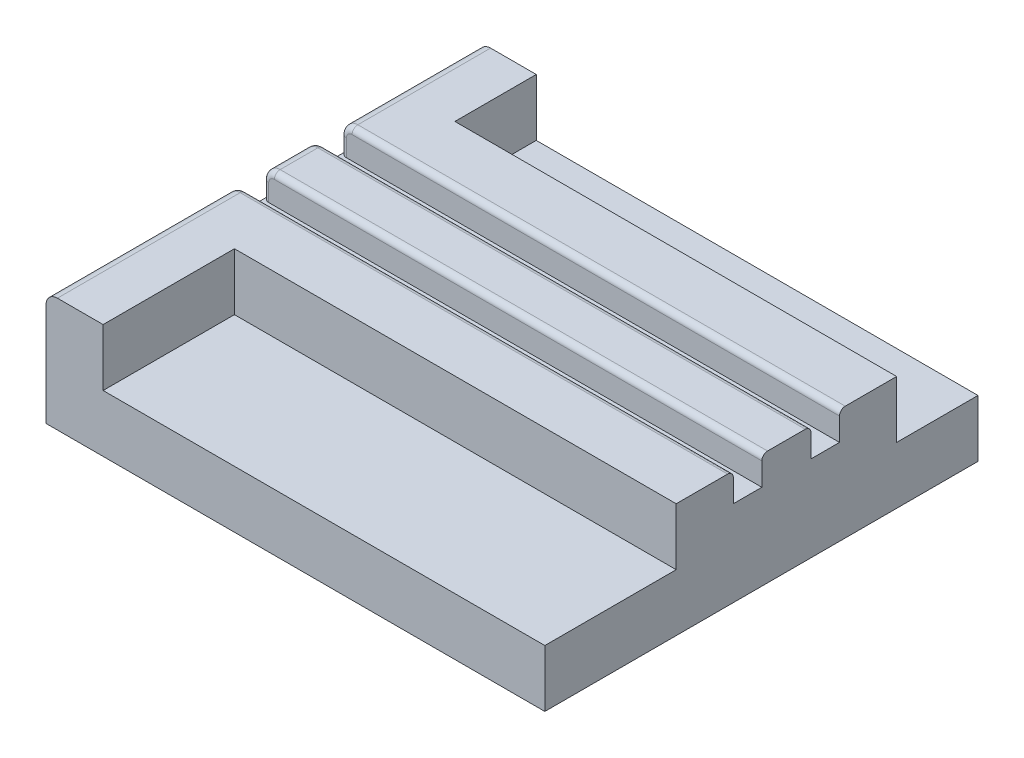
from build123d import *

# Parameters (mm, degrees)
SKETCH1_W                                  = 240
SKETCH1_H                                  = 200
BOSS_EXTRUDE1_DEPTH                        = 20
SKETCH7_W                                  = 120
SKETCH7_H                                  = 50
BOSS_EXTRUDE6_DEPTH                        = 20
FILLET1_R                                  = 2
SKETCH2_W                                  = 39.3
SKETCH2_H                                  = 125.7
CUT_EXTRUDE1_DEPTH                         = 10
CUT_EXTRUDE3_DEPTH                         = 5
MIRROR4_AT_THE_SECOND_PLANE_COPY_1_DEPTH   = 5
SKETCH11_W                                 = 104.748042719
SKETCH11_H                                 = 5
CUT_EXTRUDE4_DEPTH                         = 5
MIRROR6_AT_THE_SECOND_PLANE_COPY_1_SKETC_W = 104.748042719
MIRROR6_AT_THE_SECOND_PLANE_COPY_1_SKETC_H = 5
MIRROR6_AT_THE_SECOND_PLANE_COPY_1_DEPTH   = 5
SHELL1_START                               = 10
SHELL1_OUTLINE_W                           = 80.35
SHELL1_OUTLINE_H                           = 28.5
SHELL1_DEPTH                               = 10
FILLET3_R                                  = 1
SKETCH13_W                                 = 7.252545243
SKETCH13_H                                 = 2.335565418
SKETCH13_W_2                               = 1.720942939
SKETCH13_H_2                               = 2.581414408
CUT_EXTRUDE5_DEPTH                         = 2
CUT_EXTRUDE6_DEPTH                         = 10
MIRROR7_AT_THE_SECOND_PLANE_COPY_1_DEPTH   = 10
SKETCH15_W                                 = 101.789001661
SKETCH15_H                                 = 87.14110882
CUT_EXTRUDE7_DEPTH                         = 194.132079158
SKETCH16_W                                 = 160.143350343
SKETCH16_H                                 = 312.615723006
CUT_EXTRUDE9_DEPTH                         = 194.132079158
SKETCH17_W                                 = 90.552750052
SKETCH17_H                                 = 22.730212666
CUT_EXTRUDE10_DEPTH                        = 144.363951187


# Read off the part's stored shape, not the designer's step: Shell1
with BuildPart() as part:
    # Sketch1 → Boss-Extrude1 (new body)
    with BuildSketch(Plane(origin=(0, 0, 0), x_dir=(1, 0, 0), z_dir=(0, 1, 0))):
        Rectangle(SKETCH1_W, SKETCH1_H)
    extrude(amount=BOSS_EXTRUDE1_DEPTH)

    # Sketch7 → Boss-Extrude6 (add)
    with BuildSketch(Plane(origin=(0, 0, 0), x_dir=(1, 0, 0), z_dir=(0, 1, 0))):
        with Locations((0, 125)):
            Rectangle(SKETCH7_W, SKETCH7_H)
        with Locations((0, -125)):
            Rectangle(SKETCH7_W, SKETCH7_H)
    extrude(amount=BOSS_EXTRUDE6_DEPTH)

    # Fillet1
    fillet1_edges = [part.edges().sort_by_distance(p)[0] for p in [
        (-120, 20, 0),
        (90, 20, 100),
        (-90, 20, 100),
        (-60, 10, 150),
        (60, 10, 150),
        (-60, 20, 125),
        (0, 20, 150),
        (60, 20, 125),
        (-90, 20, -100),
        (60, 20, -125),
        (0, 20, -150),
        (60, 10, -150),
        (-60, 10, -150),
        (-60, 20, -125),
        (120, 20, 0),
        (120, 10, 100),
        (-120, 10, 100),
        (-120, 10, -100),
        (120, 10, -100),
        (90, 20, -100),
    ]]
    fillet(fillet1_edges, radius=FILLET1_R)

    # Sketch2 → Cut-Extrude1 (cut)
    with BuildSketch(Plane(origin=(0, 20, 0), x_dir=(1, 0, 0), z_dir=(0, 1, 0))):
        Rectangle(SKETCH2_W, SKETCH2_H)
    extrude(amount=-CUT_EXTRUDE1_DEPTH, mode=Mode.SUBTRACT)

    # Sketch10 → Cut-Extrude3 (cut)
    with BuildSketch(Plane(origin=(0, 20, 0), x_dir=(1, 0, 0), z_dir=(0, 1, 0))):
        Polygon((-9.25, -40.5), (-9.25, -33.162899401), (-4.25, -33.162899401), (-4.25, -40.5), (-4.25, -156.832928994), (-9.25, -156.832928994), align=None)
    cut_extrude3 = extrude(amount=-CUT_EXTRUDE3_DEPTH, mode=Mode.SUBTRACT)

    # Mirror4: Cut-Extrude3 across plane
    add(cut_extrude3.mirror(Plane(origin=(0, 0, 0), x_dir=(0, 0, 1), z_dir=(1, 0, 0))), mode=Mode.SUBTRACT)

    # Mirror4 at the second plane: Cut-Extrude3 across plane
    add(cut_extrude3.mirror(Plane.XY), mode=Mode.SUBTRACT)

    # Mirror4 at the second plane copy 1 sketc → Mirror4 at the second plane copy 1 (cut)
    with BuildSketch(Plane(origin=(0, 20, 0), x_dir=(-1, 0, 0), z_dir=(0, 1, 0))):
        Polygon((-9.25, -40.5), (-9.25, -33.162899401), (-4.25, -33.162899401), (-4.25, -40.5), (-4.25, -156.832928994), (-9.25, -156.832928994), align=None)
    extrude(amount=-MIRROR4_AT_THE_SECOND_PLANE_COPY_1_DEPTH, mode=Mode.SUBTRACT)

    # Sketch11 → Cut-Extrude4 (cut)
    with BuildSketch(Plane(origin=(0, 20, 0), x_dir=(1, 0, 0), z_dir=(0, 1, 0))):
        with Locations((-72.024021359, 26.75)):
            Rectangle(SKETCH11_W, SKETCH11_H)
        with Locations((-72.024021359, 40.35)):
            Rectangle(SKETCH11_W, SKETCH11_H)
    cut_extrude4 = extrude(amount=-CUT_EXTRUDE4_DEPTH, mode=Mode.SUBTRACT)

    # Mirror6: Cut-Extrude4 across plane
    add(cut_extrude4.mirror(Plane.XY), mode=Mode.SUBTRACT)

    # Mirror6 at the second plane: Cut-Extrude4 across plane
    add(cut_extrude4.mirror(Plane(origin=(0, 0, 0), x_dir=(0, 0, 1), z_dir=(1, 0, 0))), mode=Mode.SUBTRACT)

    # Mirror6 at the second plane copy 1 sketc → Mirror6 at the second plane copy 1 (cut)
    with BuildSketch(Plane(origin=(0, 20, 0), x_dir=(-1, 0, 0), z_dir=(0, 1, 0))):
        with Locations((-72.024021359, 26.75)):
            Rectangle(MIRROR6_AT_THE_SECOND_PLANE_COPY_1_SKETC_W, MIRROR6_AT_THE_SECOND_PLANE_COPY_1_SKETC_H)
        with Locations((-72.024021359, 40.35)):
            Rectangle(MIRROR6_AT_THE_SECOND_PLANE_COPY_1_SKETC_W, MIRROR6_AT_THE_SECOND_PLANE_COPY_1_SKETC_H)
    extrude(amount=-MIRROR6_AT_THE_SECOND_PLANE_COPY_1_DEPTH, mode=Mode.SUBTRACT)

    # Shell1 outline → Shell1 (cut)
    with BuildSketch(Plane(origin=(0, 0, 0), x_dir=(1, 0, 0), z_dir=(0, 1, 0)).offset(SHELL1_START)):
        Polygon((-29.65, 72.85), (-19.25, 72.85), (-19.25, 140), (-50, 140), (-50, 90), (-110, 90), (-110, 52.85), (-29.65, 52.85), align=None)
        Polygon((19.25, 72.85), (29.65, 72.85), (29.65, 52.85), (110, 52.85), (110, 90), (50, 90), (50, 140), (19.25, 140), align=None)
        Polygon((-110, -52.85), (-110, -90), (-50, -90), (-50, -140), (-19.25, -140), (-19.25, -72.85), (-29.65, -72.85), (-29.65, -52.85), align=None)
        with Locations((-69.825, 0)):
            Rectangle(SHELL1_OUTLINE_W, SHELL1_OUTLINE_H)
        Polygon((29.65, -72.85), (19.25, -72.85), (19.25, -140), (50, -140), (50, -90), (110, -90), (110, -52.85), (29.65, -52.85), align=None)
        with Locations((69.825, 0)):
            Rectangle(SHELL1_OUTLINE_W, SHELL1_OUTLINE_H)
    extrude(amount=SHELL1_DEPTH, mode=Mode.SUBTRACT)

    # Fillet3
    fillet3_edges = [part.edges().sort_by_distance(p)[0] for p in [
        (-4.25, 16.5, 150),
        (-4.25, 19.414213562, 149.414213562),
        (-9.25, 16.5, 150),
        (-9.25, 19.414213562, 149.414213562),
        (-4.25, 20, 105.425),
        (-9.25, 20, 105.425),
        (-9.25, 19.414213562, -149.414213562),
        (-9.25, 16.5, -150),
        (-9.25, 20, -105.425),
        (-4.25, 16.5, -150),
        (-4.25, 19.414213562, -149.414213562),
        (-4.25, 20, -105.425),
        (9.25, 16.5, 150),
        (9.25, 20, 105.425),
        (9.25, 19.414213562, 149.414213562),
        (4.25, 16.5, 150),
        (4.25, 19.414213562, 149.414213562),
        (4.25, 20, 105.425),
        (4.25, 16.5, -150),
        (4.25, 19.414213562, -149.414213562),
        (9.25, 19.414213562, -149.414213562),
        (9.25, 16.5, -150),
        (4.25, 20, -105.425),
        (9.25, 20, -105.425),
        (-120, 16.5, -24.25),
        (-120, 16.5, -29.25),
        (-119.414213562, 19.414213562, -24.25),
        (-119.414213562, 19.414213562, -29.25),
        (-68.825, 20, -24.25),
        (-68.825, 20, -29.25),
        (-120, 16.5, -37.85),
        (-120, 16.5, -42.85),
        (-68.825, 20, -37.85),
        (-68.825, 20, -42.85),
        (-119.414213562, 19.414213562, -37.85),
        (-119.414213562, 19.414213562, -42.85),
        (68.825, 20, -29.25),
        (119.414213562, 19.414213562, -29.25),
        (119.414213562, 19.414213562, -24.25),
        (68.825, 20, -24.25),
        (120, 16.5, -29.25),
        (120, 16.5, -24.25),
        (68.825, 20, -42.85),
        (119.414213562, 19.414213562, -42.85),
        (119.414213562, 19.414213562, -37.85),
        (68.825, 20, -37.85),
        (120, 16.5, -42.85),
        (120, 16.5, -37.85),
        (-120, 16.5, 29.25),
        (-120, 16.5, 24.25),
        (-68.825, 20, 29.25),
        (-119.414213562, 19.414213562, 29.25),
        (-119.414213562, 19.414213562, 24.25),
        (-68.825, 20, 24.25),
        (-120, 16.5, 42.85),
        (-120, 16.5, 37.85),
        (-68.825, 20, 42.85),
        (-119.414213562, 19.414213562, 42.85),
        (-119.414213562, 19.414213562, 37.85),
        (-68.825, 20, 37.85),
        (120, 16.5, 24.25),
        (120, 16.5, 29.25),
        (119.414213562, 19.414213562, 24.25),
        (119.414213562, 19.414213562, 29.25),
        (68.825, 20, 24.25),
        (68.825, 20, 29.25),
        (120, 16.5, 37.85),
        (120, 16.5, 42.85),
        (68.825, 20, 37.85),
        (68.825, 20, 42.85),
        (119.414213562, 19.414213562, 37.85),
        (119.414213562, 19.414213562, 42.85),
    ]]
    fillet(fillet3_edges, radius=FILLET3_R)

    # Sketch13 → Cut-Extrude5 (cut)
    # profile 1 of 12: a face of its own
    with BuildSketch(Plane(origin=(0, 10, 0), x_dir=(1, 0, 0), z_dir=(0, 1, 0))):
        Polygon((2.787359078, 56.729654742), (2.787359078, 55.37748529), (5, 55.37748529), (5, 53.041919872), (2.787359078, 53.041919872), (2.787359078, 48.247864542), (0.880108701, 48.247864542), (-4.711035156, 52.886343558), (-4.711035156, 55.37748529), (0.943491644, 55.37748529), (0.943491644, 56.729654742), align=None)
        Polygon((0.943491644, 53.041919872), (-2.596349692, 53.041919872), (0.943491644, 50.110938929), align=None, mode=Mode.SUBTRACT)
    # profile 2 of 12: a face of its own
    with BuildSketch(Plane(origin=(0, 10, 0), x_dir=(1, 0, 0), z_dir=(0, 1, 0))):
        with BuildLine():
            Line((5, 47.141544081), (5, 39.520225351))
            Line((5, 39.520225351), (3.409664338, 39.520225351))
            add(Edge.make_bspline(
                [(3.409664338, 39.520225351), (3.190599668, 39.81675512), (2.747057383, 40.417141716), (2.167094132, 41.14339637), (1.704390868, 41.703253096), (1.381972101, 42.083056551), (1.083256561, 42.417759603), (0.887687077, 42.622007507), (0.79559811, 42.718182933)],
                knots=[0, 0, 0, 0, 1.605452287, 3.25057426, 4.046675402, 4.768563423, 5.420146126, 6, 6, 6, 6], degree=3))
            add(Edge.make_bspline(
                [(0.79559811, 42.718182933), (0.732570292, 42.782561984), (0.609352585, 42.908421315), (0.423765416, 43.085974145), (0.244476812, 43.249198615), (0.074088064, 43.400664381), (-0.092796487, 43.534082219), (-0.252790737, 43.654099684), (-0.406497488, 43.759962438), (-0.599845109, 43.881290453), (-0.837875375, 44.00401532), (-1.125540586, 44.112139625), (-1.412736444, 44.178491494), (-1.604945873, 44.187117789), (-1.699385013, 44.191356186)],
                knots=[0, 0, 0, 0, 1.090093853, 2.131104457, 3.107135244, 4.023908394, 4.888948297, 5.691514549, 6.4435893, 7.146498757, 8.452673016, 9.675803408, 10.85804184, 12, 12, 12, 12], degree=3))
            add(Edge.make_bspline(
                [(-1.699385013, 44.191356186), (-1.754483363, 44.189605987), (-1.861179083, 44.186216799), (-2.017224671, 44.167846758), (-2.162681909, 44.132103765), (-2.300488192, 44.087839319), (-2.42643972, 44.024206924), (-2.544199113, 43.950411254), (-2.650531499, 43.859818439), (-2.749307162, 43.758726543), (-2.834556733, 43.642742478), (-2.911599654, 43.517157005), (-2.971430142, 43.377241787), (-3.024398474, 43.226819474), (-3.063653395, 43.063897589), (-3.092633036, 42.889340485), (-3.109905835, 42.703165878), (-3.111960528, 42.574807759), (-3.113016713, 42.508827152)],
                knots=[0, 0, 0, 0, 1.058578686, 2.049894692, 3.010224385, 3.931750511, 4.822578239, 5.71281177, 6.594427321, 7.498813824, 8.420995957, 9.353043897, 10.321837571, 11.3367408, 12.413304787, 13.535187771, 14.732999458, 16, 16, 16, 16], degree=3))
            add(Edge.make_bspline(
                [(-3.113016713, 42.508827152), (-3.110052719, 42.405568465), (-3.104041103, 42.196137688), (-3.053985994, 41.878413923), (-2.980602684, 41.552282773), (-2.873221808, 41.222921491), (-2.74714341, 40.895094854), (-2.596251992, 40.578640505), (-2.438170844, 40.269132893), (-2.314289691, 40.074405983), (-2.252545243, 39.977350819)],
                knots=[0, 0, 0, 0, 0.914703558, 1.855215137, 2.844920106, 3.875005138, 4.922433174, 5.955639304, 6.981056277, 8, 8, 8, 8], degree=3))
            Line((-2.252545243, 39.977350819), (-2.252545243, 39.766074342))
            Line((-2.252545243, 39.766074342), (-4.363389317, 39.766074342))
            add(Edge.make_bspline(
                [(-4.363389317, 39.766074342), (-4.396975153, 39.85152697), (-4.470639347, 40.038951181), (-4.568658946, 40.352153969), (-4.66491051, 40.720660415), (-4.763825821, 41.132864511), (-4.849735205, 41.573321973), (-4.910075419, 42.024211578), (-4.95119256, 42.474770211), (-4.954991729, 42.775713815), (-4.956884148, 42.92561802)],
                knots=[0, 0, 0, 0, 0.681686624, 1.495150967, 2.435076171, 3.509887788, 4.642826517, 5.765734475, 6.887081194, 8, 8, 8, 8], degree=3))
            add(Edge.make_bspline(
                [(-4.956884148, 42.92561802), (-4.954912362, 43.072306092), (-4.951074185, 43.357841566), (-4.914531776, 43.772464491), (-4.853049644, 44.160650299), (-4.769612134, 44.521836328), (-4.662431161, 44.856562797), (-4.529987596, 45.163893905), (-4.371768891, 45.443672956), (-4.191325, 45.69718541), (-3.986517109, 45.920499957), (-3.762299213, 46.116633841), (-3.516918106, 46.283180062), (-3.250583577, 46.417510178), (-2.964907945, 46.521931142), (-2.659732708, 46.596780352), (-2.333869778, 46.641015432), (-2.109911454, 46.646854566), (-1.995172081, 46.649846099)],
                knots=[0, 0, 0, 0, 1.302669921, 2.535710425, 3.693104205, 4.791067539, 5.825099944, 6.810730835, 7.758000335, 8.67487823, 9.568447078, 10.443087854, 11.315285082, 12.19521531, 13.085757283, 14.011200708, 14.981089066, 16, 16, 16, 16], degree=3))
            add(Edge.make_bspline(
                [(-1.995172081, 46.649846099), (-1.918295051, 46.648245135), (-1.764899121, 46.645050664), (-1.536586701, 46.623146341), (-1.311198259, 46.589276583), (-1.089189633, 46.538876948), (-0.870129482, 46.472993238), (-0.653296175, 46.39436831), (-0.439122967, 46.302496277), (-0.229338943, 46.193054838), (-0.018163961, 46.072147599), (0.191952814, 45.932794317), (0.405837655, 45.781094454), (0.620958688, 45.614342324), (0.835471411, 45.430057751), (1.055741697, 45.23549192), (1.273520634, 45.021368665), (1.417594688, 44.872241147), (1.490889788, 44.796375188)],
                knots=[0, 0, 0, 0, 0.907170522, 1.810115022, 2.704515666, 3.595334857, 4.494160497, 5.402400165, 6.316123003, 7.242010315, 8.19323076, 9.186549597, 10.215937183, 11.28746875, 12.397107329, 13.552885457, 14.755074217, 16, 16, 16, 16], degree=3))
            add(Edge.make_bspline(
                [(1.490889788, 44.796375188), (1.669671754, 44.600991906), (2.021428479, 44.216571794), (2.422503942, 43.720261203), (2.710127438, 43.347225494), (2.892573427, 43.11547907), (3.035611297, 42.923413887), (3.11966375, 42.809753418), (3.156132565, 42.760438229)],
                knots=[0, 0, 0, 0, 1.811045763, 3.563265038, 4.362127914, 5.033096026, 5.580478129, 6, 6, 6, 6], degree=3))
            Line((3.156132565, 42.760438229), (3.156132565, 47.141544081))
            Line((3.156132565, 47.141544081), (5, 47.141544081))
        make_face()
    # profile 3 of 12: a face of its own
    with BuildSketch(Plane(origin=(0, 10, 0), x_dir=(1, 0, 0), z_dir=(0, 1, 0))):
        with BuildLine():
            add(Edge.make_bspline(
                [(0.138720336, 37.553433421), (0.339837036, 37.551198694), (0.731017162, 37.546852061), (1.301575539, 37.503210957), (1.839727263, 37.435290008), (2.344336806, 37.340402007), (2.812295891, 37.218717557), (3.235819492, 37.059739443), (3.620265586, 36.877229499), (3.845547684, 36.720963882), (3.955141787, 36.64494457)],
                knots=[0, 0, 0, 0, 1.210994604, 2.355433537, 3.443919748, 4.476135166, 5.446013627, 6.351277171, 7.197937607, 8, 8, 8, 8], degree=3))
            add(Edge.make_bspline(
                [(3.955141787, 36.64494457), (4.057367971, 36.5617232), (4.260610648, 36.396265258), (4.524020765, 36.101981434), (4.745368417, 35.772676286), (4.897303004, 35.472877401), (4.999247268, 35.217133399), (5.063592063, 35.011802969), (5.122267484, 34.796985151), (5.167723638, 34.570405454), (5.201934481, 34.333084121), (5.226664862, 34.085073274), (5.242295446, 33.825562266), (5.244648027, 33.648682389), (5.245848991, 33.558387312)],
                knots=[0, 0, 0, 0, 1.363120718, 2.710110989, 4.070537742, 5.460816644, 6.180869889, 6.918733188, 7.687278466, 8.485437086, 9.309407483, 10.168795045, 11.065191617, 12, 12, 12, 12], degree=3))
            add(Edge.make_bspline(
                [(5.245848991, 33.558387312), (5.241905689, 33.384062955), (5.234297073, 33.047703496), (5.173081199, 32.562988904), (5.069699732, 32.118069919), (4.926806373, 31.711596248), (4.739854178, 31.34454147), (4.516760058, 31.013155063), (4.251279595, 30.717979546), (4.045332533, 30.554230832), (3.94169692, 30.471830054)],
                knots=[0, 0, 0, 0, 1.200851745, 2.317047666, 3.359233085, 4.342911255, 5.278031965, 6.189548012, 7.088953741, 8, 8, 8, 8], degree=3))
            add(Edge.make_bspline(
                [(3.94169692, 30.471830054), (3.829424185, 30.3947628), (3.600170882, 30.2373967), (3.214838014, 30.049115343), (2.792701976, 29.89168932), (2.331256748, 29.768085058), (1.834031119, 29.675388633), (1.301418942, 29.61187027), (0.734794995, 29.570336966), (0.344952566, 29.565716964), (0.144482422, 29.563341204)],
                knots=[0, 0, 0, 0, 0.822750793, 1.680001256, 2.58557045, 3.544707477, 4.565467581, 5.642347189, 6.787615291, 8, 8, 8, 8], degree=3))
            add(Edge.make_bspline(
                [(0.144482422, 29.563341204), (-0.061754837, 29.565532126), (-0.459970452, 29.569762495), (-1.036345286, 29.613069323), (-1.570746564, 29.680774054), (-2.065452333, 29.775711056), (-2.521358164, 29.900947264), (-2.938473361, 30.06222162), (-3.323134476, 30.249194002), (-3.55325365, 30.406272972), (-3.666176943, 30.483354226)],
                knots=[0, 0, 0, 0, 1.242237956, 2.39858964, 3.479780431, 4.485821505, 5.430991799, 6.32348679, 7.177307181, 8, 8, 8, 8], degree=3))
            add(Edge.make_bspline(
                [(-3.666176943, 30.483354226), (-3.769193286, 30.566416838), (-3.974708441, 30.732124775), (-4.238285133, 31.029639616), (-4.461065672, 31.362253167), (-4.645070962, 31.729678272), (-4.784115122, 32.135791847), (-4.885860052, 32.577168574), (-4.944671996, 33.056148657), (-4.952723667, 33.387282789), (-4.956884148, 33.558387312)],
                knots=[0, 0, 0, 0, 0.915406887, 1.826214983, 2.74012738, 3.682217607, 4.664024873, 5.706462388, 6.814877053, 8, 8, 8, 8], degree=3))
            add(Edge.make_bspline(
                [(-4.956884148, 33.558387312), (-4.955682618, 33.64868302), (-4.953320425, 33.826203271), (-4.937576888, 34.086978277), (-4.913381513, 34.337057391), (-4.877300412, 34.575699285), (-4.828262853, 34.80214551), (-4.773499009, 35.018778584), (-4.706561244, 35.224310597), (-4.601886899, 35.480626422), (-4.447267393, 35.781827029), (-4.217150947, 36.109134402), (-3.948246131, 36.405401156), (-3.739143401, 36.569659884), (-3.633525124, 36.652627351)],
                knots=[0, 0, 0, 0, 0.927772364, 1.823989051, 2.683453821, 3.508702832, 4.302191287, 5.063276402, 5.803871599, 6.520953588, 7.906777029, 9.27188215, 10.622021304, 12, 12, 12, 12], degree=3))
            add(Edge.make_bspline(
                [(-3.633525124, 36.652627351), (-3.521300204, 36.729189524), (-3.292789343, 36.885084383), (-2.908970475, 37.068290297), (-2.492360426, 37.225455121), (-2.036263275, 37.346342452), (-1.54437137, 37.439204828), (-1.015826808, 37.505677425), (-0.450933502, 37.546286922), (-0.061742996, 37.551003841), (0.138720336, 37.553433421)],
                knots=[0, 0, 0, 0, 0.826423845, 1.682753026, 2.582377666, 3.535958882, 4.552416628, 5.629628825, 6.779074777, 8, 8, 8, 8], degree=3))
        make_face()
        with BuildLine():
            add(Edge.make_bspline(
                [(0.138720336, 35.094943508), (-0.002794049, 35.093990238), (-0.275052116, 35.092156251), (-0.667644343, 35.074004214), (-1.028464631, 35.048543297), (-1.357952356, 35.010483072), (-1.656192237, 34.961169576), (-1.923473104, 34.900935006), (-2.158488294, 34.828227196), (-2.363936988, 34.745989678), (-2.54162794, 34.64913888), (-2.69467252, 34.537908006), (-2.823572221, 34.410664927), (-2.931286275, 34.270097317), (-3.011274034, 34.111739825), (-3.072443859, 33.941187009), (-3.106785969, 33.754382189), (-3.110895684, 33.625106618), (-3.113016713, 33.558387312)],
                knots=[0, 0, 0, 0, 1.684598718, 3.240982106, 4.677870026, 5.990101975, 7.188004416, 8.275163324, 9.249099904, 10.113910365, 10.905306099, 11.652292794, 12.358339015, 13.054983843, 13.750418457, 14.461547751, 15.206002611, 16, 16, 16, 16], degree=3))
            add(Edge.make_bspline(
                [(-3.113016713, 33.558387312), (-3.110895681, 33.491668012), (-3.106785962, 33.362392453), (-3.072443884, 33.175587552), (-3.011273943, 33.005035023), (-2.931286606, 32.84667649), (-2.823570979, 32.706112772), (-2.694677343, 32.578854684), (-2.541608299, 32.467684345), (-2.363496496, 32.37029911), (-2.157013742, 32.289020864), (-1.921590867, 32.215742751), (-1.654258135, 32.155647372), (-1.355414385, 32.106122047), (-1.024612933, 32.068276855), (-0.661244964, 32.04269777), (-0.266085327, 32.024665897), (0.008090715, 32.022799039), (0.150244508, 32.021831116)],
                knots=[0, 0, 0, 0, 0.791766581, 1.534129826, 2.243261137, 2.936741863, 3.631429404, 4.335491923, 5.08037989, 5.869552125, 6.738971147, 7.710171362, 8.794275798, 9.988812621, 11.304907075, 12.745337551, 14.312534512, 16, 16, 16, 16], degree=3))
            add(Edge.make_bspline(
                [(0.150244508, 32.021831116), (0.289201434, 32.022765136), (0.556986265, 32.024565091), (0.943773412, 32.043063349), (1.30096878, 32.067483158), (1.627502144, 32.109075315), (1.924420257, 32.156514098), (2.190195476, 32.220950105), (2.427221865, 32.292197549), (2.635687527, 32.376524358), (2.816464841, 32.475577579), (2.974492505, 32.586386469), (3.106149375, 32.714997304), (3.215613674, 32.855867424), (3.298888327, 33.012083539), (3.358752163, 33.181622444), (3.396338685, 33.365314373), (3.400067537, 33.492898418), (3.401981557, 33.558387312)],
                knots=[0, 0, 0, 0, 1.658832269, 3.196746878, 4.622488866, 5.931787449, 7.125569234, 8.210133994, 9.194149195, 10.078471196, 10.889203548, 11.650697572, 12.375032472, 13.07829054, 13.77251817, 14.478471121, 15.218999177, 16, 16, 16, 16], degree=3))
            add(Edge.make_bspline(
                [(3.401981557, 33.558387312), (3.400068186, 33.623876875), (3.3963406, 33.751462223), (3.358745104, 33.935144911), (3.298913291, 34.10471679), (3.215521541, 34.260812329), (3.106775331, 34.40178813), (2.97377315, 34.528364287), (2.816557237, 34.639341559), (2.635707586, 34.738476019), (2.42683161, 34.821967534), (2.190341985, 34.897522561), (1.921851262, 34.956560743), (1.624132619, 35.009519497), (1.295502071, 35.045529443), (0.936895825, 35.074962985), (0.547988509, 35.091838226), (0.278306115, 35.093884415), (0.138720336, 35.094943508)],
                knots=[0, 0, 0, 0, 0.778971247, 1.517574904, 2.221693305, 2.914116855, 3.615547377, 4.332711038, 5.092226179, 5.900851692, 6.782875619, 7.766611013, 8.854037796, 10.053520173, 11.366075456, 12.788704916, 14.337855446, 16, 16, 16, 16], degree=3))
        make_face(mode=Mode.SUBTRACT)
    # profile 4 of 12: a face of its own
    with BuildSketch(Plane(origin=(0, 10, 0), x_dir=(1, 0, 0), z_dir=(0, 1, 0))):
        with BuildLine():
            Line((5, 28.211171751), (5, 20.589853021))
            Line((5, 20.589853021), (3.409664338, 20.589853021))
            add(Edge.make_bspline(
                [(3.409664338, 20.589853021), (3.190599668, 20.88638279), (2.747057383, 21.486769386), (2.167094132, 22.21302404), (1.704390868, 22.772880767), (1.381972101, 23.152684221), (1.083256561, 23.487387273), (0.887687077, 23.691635177), (0.79559811, 23.787810603)],
                knots=[0, 0, 0, 0, 1.605452287, 3.25057426, 4.046675402, 4.768563423, 5.420146126, 6, 6, 6, 6], degree=3))
            add(Edge.make_bspline(
                [(0.79559811, 23.787810603), (0.732570292, 23.852189654), (0.609352585, 23.978048985), (0.423765416, 24.155601815), (0.244476812, 24.318826285), (0.074088064, 24.470292051), (-0.092796487, 24.60370989), (-0.252790737, 24.723727355), (-0.406497488, 24.829590108), (-0.599845109, 24.950918123), (-0.837875375, 25.07364299), (-1.125540586, 25.181767295), (-1.412736444, 25.248119164), (-1.604945873, 25.256745459), (-1.699385013, 25.260983856)],
                knots=[0, 0, 0, 0, 1.090093853, 2.131104457, 3.107135244, 4.023908394, 4.888948297, 5.691514549, 6.4435893, 7.146498757, 8.452673016, 9.675803408, 10.85804184, 12, 12, 12, 12], degree=3))
            add(Edge.make_bspline(
                [(-1.699385013, 25.260983856), (-1.754483363, 25.259233658), (-1.861179083, 25.25584447), (-2.017224671, 25.237474428), (-2.162681909, 25.201731435), (-2.300488192, 25.157466989), (-2.42643972, 25.093834595), (-2.544199113, 25.020038924), (-2.650531499, 24.929446109), (-2.749307162, 24.828354213), (-2.834556733, 24.712370148), (-2.911599654, 24.586784675), (-2.971430142, 24.446869457), (-3.024398474, 24.296447144), (-3.063653395, 24.133525259), (-3.092633036, 23.958968155), (-3.109905835, 23.772793548), (-3.111960528, 23.644435429), (-3.113016713, 23.578454822)],
                knots=[0, 0, 0, 0, 1.058578686, 2.049894692, 3.010224385, 3.931750511, 4.822578239, 5.71281177, 6.594427321, 7.498813824, 8.420995957, 9.353043897, 10.321837571, 11.3367408, 12.413304787, 13.535187771, 14.732999458, 16, 16, 16, 16], degree=3))
            add(Edge.make_bspline(
                [(-3.113016713, 23.578454822), (-3.110052719, 23.475196136), (-3.104041103, 23.265765358), (-3.053985994, 22.948041593), (-2.980602684, 22.621910443), (-2.873221808, 22.292549161), (-2.74714341, 21.964722525), (-2.596251992, 21.648268175), (-2.438170844, 21.338760563), (-2.314289691, 21.144033653), (-2.252545243, 21.046978489)],
                knots=[0, 0, 0, 0, 0.914703558, 1.855215137, 2.844920106, 3.875005138, 4.922433174, 5.955639304, 6.981056277, 8, 8, 8, 8], degree=3))
            Line((-2.252545243, 21.046978489), (-2.252545243, 20.835702012))
            Line((-2.252545243, 20.835702012), (-4.363389317, 20.835702012))
            add(Edge.make_bspline(
                [(-4.363389317, 20.835702012), (-4.396975153, 20.92115464), (-4.470639347, 21.108578851), (-4.568658946, 21.421781639), (-4.66491051, 21.790288086), (-4.763825821, 22.202492181), (-4.849735205, 22.642949643), (-4.910075419, 23.093839248), (-4.95119256, 23.544397881), (-4.954991729, 23.845341485), (-4.956884148, 23.99524569)],
                knots=[0, 0, 0, 0, 0.681686624, 1.495150967, 2.435076171, 3.509887788, 4.642826517, 5.765734475, 6.887081194, 8, 8, 8, 8], degree=3))
            add(Edge.make_bspline(
                [(-4.956884148, 23.99524569), (-4.954912362, 24.141933762), (-4.951074185, 24.427469237), (-4.914531776, 24.842092162), (-4.853049644, 25.230277969), (-4.769612134, 25.591463998), (-4.662431161, 25.926190468), (-4.529987596, 26.233521576), (-4.371768891, 26.513300626), (-4.191325, 26.76681308), (-3.986517109, 26.990127627), (-3.762299213, 27.186261512), (-3.516918106, 27.352807733), (-3.250583577, 27.487137848), (-2.964907945, 27.591558812), (-2.659732708, 27.666408023), (-2.333869778, 27.710643103), (-2.109911454, 27.716482236), (-1.995172081, 27.719473769)],
                knots=[0, 0, 0, 0, 1.302669921, 2.535710425, 3.693104205, 4.791067539, 5.825099944, 6.810730835, 7.758000335, 8.67487823, 9.568447078, 10.443087854, 11.315285082, 12.19521531, 13.085757283, 14.011200708, 14.981089066, 16, 16, 16, 16], degree=3))
            add(Edge.make_bspline(
                [(-1.995172081, 27.719473769), (-1.918295051, 27.717872805), (-1.764899121, 27.714678334), (-1.536586701, 27.692774011), (-1.311198259, 27.658904253), (-1.089189633, 27.608504619), (-0.870129482, 27.542620908), (-0.653296175, 27.46399598), (-0.439122967, 27.372123947), (-0.229338943, 27.262682508), (-0.018163961, 27.141775269), (0.191952814, 27.002421987), (0.405837655, 26.850722124), (0.620958688, 26.683969994), (0.835471411, 26.499685422), (1.055741697, 26.30511959), (1.273520634, 26.090996335), (1.417594688, 25.941868817), (1.490889788, 25.866002858)],
                knots=[0, 0, 0, 0, 0.907170522, 1.810115022, 2.704515666, 3.595334857, 4.494160497, 5.402400165, 6.316123003, 7.242010315, 8.19323076, 9.186549597, 10.215937183, 11.28746875, 12.397107329, 13.552885457, 14.755074217, 16, 16, 16, 16], degree=3))
            add(Edge.make_bspline(
                [(1.490889788, 25.866002858), (1.669671754, 25.670619576), (2.021428479, 25.286199464), (2.422503942, 24.789888873), (2.710127438, 24.416853164), (2.892573427, 24.18510674), (3.035611297, 23.993041557), (3.11966375, 23.879381088), (3.156132565, 23.830065899)],
                knots=[0, 0, 0, 0, 1.811045763, 3.563265038, 4.362127914, 5.033096026, 5.580478129, 6, 6, 6, 6], degree=3))
            Line((3.156132565, 23.830065899), (3.156132565, 28.211171751))
            Line((3.156132565, 28.211171751), (5, 28.211171751))
        make_face()
    # profile 5 of 12: a face of its own
    with BuildSketch(Plane(origin=(0, 10, 0), x_dir=(1, 0, 0), z_dir=(0, 1, 0))):
        Polygon((5, 13.583156769), (5, 11.124666856), (-1.524601746, 11.124666856), (2.664434583, 9.338420279), (2.664434583, 7.625160121), (-1.524601746, 5.838913543), (5, 5.838913543), (5, 3.503348126), (-4.711035156, 3.503348126), (-4.711035156, 6.382470298), (0.125275469, 8.549014533), (-4.711035156, 10.709796683), (-4.711035156, 13.583156769), align=None)
    # profile 6 of 12: a face of its own
    with BuildSketch(Plane(origin=(0, 10, 0), x_dir=(1, 0, 0), z_dir=(0, 1, 0))):
        Polygon((5, 1.4136317), (5, -5.593064552), (-4.711035156, -5.593064552), (-4.711035156, 1.4136317), (-2.867167722, 1.4136317), (-2.867167722, -3.134574639), (-1.146224782, -3.134574639), (-1.146224782, 1.044858213), (0.697642652, 1.044858213), (0.697642652, -3.134574639), (3.156132565, -3.134574639), (3.156132565, 1.4136317), align=None)
    # profile 7 of 12: a face of its own
    with BuildSketch(Plane(origin=(0, 10, 0), x_dir=(1, 0, 0), z_dir=(0, 1, 0))):
        with BuildLine():
            add(Edge.make_bspline(
                [(4.475650198, -7.805705474), (4.519354839, -7.923859504), (4.612512661, -8.17570855), (4.743574124, -8.583890089), (4.866671289, -9.047274178), (4.996208031, -9.552124696), (5.106381276, -10.084227717), (5.187397941, -10.625264318), (5.237323662, -11.165972628), (5.243010567, -11.526628491), (5.245848991, -11.706637515)],
                knots=[0, 0, 0, 0, 0.756485239, 1.612472169, 2.573171414, 3.635272123, 4.742182008, 5.834553763, 6.919191659, 8, 8, 8, 8], degree=3))
            add(Edge.make_bspline(
                [(5.245848991, -11.706637515), (5.241962961, -11.909112321), (5.234392087, -12.303579456), (5.17063924, -12.878829296), (5.062937634, -13.419584917), (4.916847086, -13.928231287), (4.72267015, -14.400885619), (4.491042888, -14.842463027), (4.211679163, -15.247896521), (3.893490591, -15.618759753), (3.53655883, -15.9505899), (3.145758166, -16.239699566), (2.72146993, -16.48347792), (2.264846611, -16.681095463), (1.776896349, -16.838089964), (1.255150105, -16.944841813), (0.702111097, -17.014888699), (0.322052776, -17.021601157), (0.127196165, -17.025042647)],
                knots=[0, 0, 0, 0, 1.160705024, 2.261318311, 3.313123859, 4.319096107, 5.290496718, 6.238021168, 7.172737693, 8.107230733, 9.03451477, 9.961071912, 10.888559376, 11.833805606, 12.808979065, 13.821966168, 14.883317984, 16, 16, 16, 16], degree=3))
            add(Edge.make_bspline(
                [(0.127196165, -17.025042647), (-0.058682323, -17.02067815), (-0.422730133, -17.012130168), (-0.955049114, -16.943336637), (-1.460067022, -16.832867692), (-1.937766829, -16.677677821), (-2.386372436, -16.473696921), (-2.808700267, -16.227656485), (-3.203463564, -15.935836699), (-3.565000576, -15.598836264), (-3.895700628, -15.226075236), (-4.177610929, -14.810267907), (-4.422741814, -14.363406013), (-4.616779655, -13.8775432), (-4.772219277, -13.359136807), (-4.876169413, -12.804694831), (-4.946971316, -12.216810998), (-4.953520434, -11.812500101), (-4.956884148, -11.604840667)],
                knots=[0, 0, 0, 0, 1.061573339, 2.079118747, 3.060574866, 4.011305467, 4.942696719, 5.870461571, 6.798745348, 7.740825567, 8.68941507, 9.638984161, 10.604583371, 11.595514188, 12.621960228, 13.691449096, 14.814297672, 16, 16, 16, 16], degree=3))
            add(Edge.make_bspline(
                [(-4.956884148, -11.604840667), (-4.954318925, -11.445386322), (-4.949235323, -11.129389392), (-4.919388643, -10.661251886), (-4.863951384, -10.205248288), (-4.792453594, -9.753475749), (-4.684946461, -9.294730481), (-4.534849919, -8.818874824), (-4.346707534, -8.316660693), (-4.193287983, -7.980233106), (-4.113698935, -7.805705474)],
                knots=[0, 0, 0, 0, 0.974479143, 1.931163549, 2.86485946, 3.780778834, 4.725046501, 5.741022375, 6.828116267, 8, 8, 8, 8], degree=3))
            Line((-4.113698935, -7.805705474), (-1.883771756, -7.805705474))
            Line((-1.883771756, -7.805705474), (-1.883771756, -8.091889065))
            add(Edge.make_bspline(
                [(-1.883771756, -8.091889065), (-1.906716104, -8.126531064), (-1.957410079, -8.203070203), (-2.043059993, -8.326945943), (-2.137489474, -8.476111594), (-2.284548962, -8.694884397), (-2.45960062, -8.978067997), (-2.581693909, -9.213466955), (-2.640525683, -9.326896107)],
                knots=[0, 0, 0, 0, 0.515980687, 1.140024195, 1.869947604, 2.707876564, 4.413660046, 6, 6, 6, 6], degree=3))
            add(Edge.make_bspline(
                [(-2.640525683, -9.326896107), (-2.672756546, -9.393740863), (-2.73882048, -9.530753251), (-2.823836627, -9.749019276), (-2.905177649, -9.981830174), (-2.978097, -10.22950925), (-3.037034138, -10.489919732), (-3.082413494, -10.759686706), (-3.106467195, -11.03779789), (-3.110821171, -11.225783758), (-3.113016713, -11.320577771)],
                knots=[0, 0, 0, 0, 0.861448091, 1.765719082, 2.717953576, 3.724891765, 4.761927522, 5.816719679, 6.89905606, 8, 8, 8, 8], degree=3))
            add(Edge.make_bspline(
                [(-3.113016713, -11.320577771), (-3.110164997, -11.430782772), (-3.104578279, -11.646682304), (-3.068710383, -11.963218824), (-3.004292393, -12.263584213), (-2.918860854, -12.549882667), (-2.805175217, -12.820581595), (-2.662381265, -13.075068024), (-2.499039638, -13.320076357), (-2.36711736, -13.466852812), (-2.300562624, -13.540901474)],
                knots=[0, 0, 0, 0, 1.091217493, 2.137773647, 3.148547478, 4.129133693, 5.092188092, 6.048375109, 7.015406034, 8, 8, 8, 8], degree=3))
            add(Edge.make_bspline(
                [(-2.300562624, -13.540901474), (-2.231129169, -13.608753509), (-2.090799964, -13.745886571), (-1.846186727, -13.91943259), (-1.579009792, -14.07619004), (-1.283734201, -14.208811415), (-0.962723927, -14.314570988), (-0.616833633, -14.387928819), (-0.248028071, -14.435679856), (0.006035391, -14.440927383), (0.136799641, -14.443628239)],
                knots=[0, 0, 0, 0, 0.871242595, 1.760833901, 2.686460846, 3.652134751, 4.663748384, 5.717797841, 6.825370436, 8, 8, 8, 8], degree=3))
            add(Edge.make_bspline(
                [(0.136799641, -14.443628239), (0.270078203, -14.441217619), (0.528956778, -14.436535262), (0.904701948, -14.395518364), (1.257245759, -14.329288021), (1.585144219, -14.233472949), (1.889752999, -14.11198958), (2.170660406, -13.964565335), (2.424839249, -13.78559248), (2.657673098, -13.584235453), (2.862193118, -13.352834409), (3.041867765, -13.096983341), (3.191530728, -12.813783401), (3.315763592, -12.506455713), (3.407777269, -12.172177215), (3.477785429, -11.813452581), (3.51753353, -11.428392977), (3.522401475, -11.163169785), (3.524906052, -11.026711399)],
                knots=[0, 0, 0, 0, 1.162877018, 2.258757441, 3.29433279, 4.289818334, 5.235063129, 6.152415668, 7.05144509, 7.94239879, 8.832861761, 9.739671241, 10.664582224, 11.622279774, 12.626959197, 13.685538709, 14.809200461, 16, 16, 16, 16], degree=3))
            add(Edge.make_bspline(
                [(3.524906052, -11.026711399), (3.524545414, -10.976125561), (3.523787414, -10.869802624), (3.51698298, -10.707868976), (3.511542352, -10.544994826), (3.50110347, -10.438303115), (3.496095624, -10.387119882)],
                knots=[0, 0, 0, 0, 0.947728294, 1.991965744, 3.036685378, 4, 4, 4, 4], degree=3))
            Line((3.496095624, -10.387119882), (1.435189626, -10.387119882))
            Line((1.435189626, -10.387119882), (1.435189626, -12.353911813))
            Line((1.435189626, -12.353911813), (-0.408677809, -12.353911813))
            Line((-0.408677809, -12.353911813), (-0.408677809, -7.805705474))
            Line((-0.408677809, -7.805705474), (4.475650198, -7.805705474))
        make_face()
    # profile 8 of 12: a face of its own
    with BuildSketch(Plane(origin=(0, 10, 0), x_dir=(1, 0, 0), z_dir=(0, 1, 0))):
        with Locations((1.373727378, -19.913768295)):
            Rectangle(SKETCH13_W, SKETCH13_H)
    # profile 9 of 12: a face of its own
    with BuildSketch(Plane(origin=(0, 10, 0), x_dir=(1, 0, 0), z_dir=(0, 1, 0))):
        with Locations((-4.219337174, -19.913768295)):
            Rectangle(SKETCH13_W_2, SKETCH13_H_2)
    # profile 10 of 12: a face of its own
    with BuildSketch(Plane(origin=(0, 10, 0), x_dir=(1, 0, 0), z_dir=(0, 1, 0))):
        with BuildLine():
            add(Edge.make_bspline(
                [(5.245848991, -30.773379208), (5.241556228, -30.949600555), (5.233101922, -31.296656552), (5.17328717, -31.807137753), (5.071443943, -32.296870987), (4.929457053, -32.76358831), (4.750483589, -33.205121013), (4.527408056, -33.614715808), (4.267338932, -33.994815031), (4.061606502, -34.220067298), (3.958983177, -34.332427496)],
                knots=[0, 0, 0, 0, 1.089850102, 2.146385891, 3.173869964, 4.179760968, 5.160008291, 6.115072822, 7.059761785, 8, 8, 8, 8], degree=3))
            add(Edge.make_bspline(
                [(3.958983177, -34.332427496), (3.848038568, -34.438295465), (3.624492228, -34.651612698), (3.240912088, -34.92404395), (2.819806379, -35.161121156), (2.440058042, -35.326067869), (2.118408243, -35.437370727), (1.865302565, -35.510926057), (1.602961267, -35.571890876), (1.331038558, -35.621175666), (1.050675199, -35.662875321), (0.76008365, -35.687900337), (0.460358885, -35.70657835), (0.257194686, -35.708560179), (0.154085898, -35.709565986)],
                knots=[0, 0, 0, 0, 1.326589366, 2.672993315, 4.060770367, 5.505883836, 6.25107509, 7.007321983, 7.7873399, 8.582269437, 9.400071632, 10.240855478, 11.107208546, 12, 12, 12, 12], degree=3))
            add(Edge.make_bspline(
                [(0.154085898, -35.709565986), (-0.036260272, -35.705853317), (-0.409159179, -35.698579988), (-0.954067146, -35.631518817), (-1.472101576, -35.524248732), (-1.962272567, -35.375865598), (-2.421254864, -35.182794221), (-2.847342954, -34.951680217), (-3.242424741, -34.683652344), (-3.47520079, -34.471076121), (-3.591269829, -34.365079315)],
                knots=[0, 0, 0, 0, 1.119324668, 2.1928203, 3.223958197, 4.228260008, 5.200520162, 6.147632129, 7.076354466, 8, 8, 8, 8], degree=3))
            add(Edge.make_bspline(
                [(-3.591269829, -34.365079315), (-3.696426816, -34.256022231), (-3.907914238, -34.036691095), (-4.17855444, -33.660997219), (-4.413868173, -33.249571895), (-4.610724175, -32.802820982), (-4.765892728, -32.325941651), (-4.877010675, -31.82562766), (-4.943259501, -31.303347455), (-4.952287649, -30.948354573), (-4.956884148, -30.767617122)],
                knots=[0, 0, 0, 0, 0.919195442, 1.8486482, 2.803167129, 3.793795735, 4.808307604, 5.844199062, 6.902417522, 8, 8, 8, 8], degree=3))
            add(Edge.make_bspline(
                [(-4.956884148, -30.767617122), (-4.956393428, -30.668359933), (-4.955436829, -30.474869682), (-4.94084827, -30.191814102), (-4.921289403, -29.923828157), (-4.879474294, -29.592200908), (-4.814808823, -29.204474119), (-4.7421777, -28.904822537), (-4.707193766, -28.760490591)],
                knots=[0, 0, 0, 0, 0.880714095, 1.716848845, 2.514717796, 3.264532192, 4.682418473, 6, 6, 6, 6], degree=3))
            add(Edge.make_bspline(
                [(-4.707193766, -28.760490591), (-4.664108705, -28.621612355), (-4.581310973, -28.354726269), (-4.434982607, -27.98111963), (-4.28414942, -27.652264541), (-4.186257609, -27.446632632), (-4.140588669, -27.350700282)],
                knots=[0, 0, 0, 0, 1.146660616, 2.203568899, 3.161920647, 4, 4, 4, 4], degree=3))
            Line((-4.140588669, -27.350700282), (-1.760847261, -27.350700282))
            Line((-1.760847261, -27.350700282), (-1.760847261, -27.636883873))
            add(Edge.make_bspline(
                [(-1.760847261, -27.636883873), (-1.789760882, -27.669445598), (-1.850028949, -27.737317837), (-1.943169449, -27.84646079), (-2.044289807, -27.966859077), (-2.193791638, -28.146156267), (-2.382825876, -28.396964235), (-2.52216278, -28.612309765), (-2.594428997, -28.723997382)],
                knots=[0, 0, 0, 0, 0.571444814, 1.191129738, 1.882836886, 2.634784766, 4.254652092, 6, 6, 6, 6], degree=3))
            add(Edge.make_bspline(
                [(-2.594428997, -28.723997382), (-2.664236929, -28.846886536), (-2.805685787, -29.09589163), (-2.943550161, -29.429418426), (-3.032587435, -29.709146116), (-3.077362003, -29.929392289), (-3.107853006, -30.156624515), (-3.111280534, -30.311028434), (-3.113016713, -30.389240159)],
                knots=[0, 0, 0, 0, 1.439173741, 2.916136845, 3.667290802, 4.427345131, 5.203387771, 6, 6, 6, 6], degree=3))
            add(Edge.make_bspline(
                [(-3.113016713, -30.389240159), (-3.110477824, -30.475745648), (-3.105440763, -30.647369353), (-3.07497042, -30.902187581), (-3.020147889, -31.150575186), (-2.946619655, -31.393340851), (-2.845477271, -31.627774464), (-2.718252775, -31.853674636), (-2.562057311, -32.070037457), (-2.439651919, -32.20231689), (-2.377390434, -32.269600803)],
                knots=[0, 0, 0, 0, 1.001598119, 1.9871338, 2.96553644, 3.943152672, 4.919306753, 5.914963555, 6.939446524, 8, 8, 8, 8], degree=3))
            add(Edge.make_bspline(
                [(-2.377390434, -32.269600803), (-2.309583745, -32.332034441), (-2.171025631, -32.45961311), (-1.93152049, -32.625206542), (-1.660665123, -32.770051169), (-1.360441958, -32.900067806), (-1.026703819, -33.004078191), (-0.659549693, -33.075068855), (-0.259970233, -33.119887624), (0.017588233, -33.125326369), (0.161768679, -33.128151577)],
                knots=[0, 0, 0, 0, 0.80388915, 1.642689914, 2.53299325, 3.481872775, 4.4947599, 5.577680681, 6.741702658, 8, 8, 8, 8], degree=3))
            add(Edge.make_bspline(
                [(0.161768679, -33.128151577), (0.311768837, -33.125923628), (0.599876693, -33.121644368), (1.011428999, -33.069407329), (1.386636838, -32.994288328), (1.721395513, -32.879071876), (2.020823568, -32.741957475), (2.287301408, -32.588864868), (2.521133588, -32.418332338), (2.653723475, -32.287257692), (2.71821405, -32.223504117)],
                knots=[0, 0, 0, 0, 1.290334302, 2.478367041, 3.565730986, 4.578276722, 5.517838544, 6.396912514, 7.220272109, 8, 8, 8, 8], degree=3))
            add(Edge.make_bspline(
                [(2.71821405, -32.223504117), (2.776624204, -32.15678903), (2.892154246, -32.024832576), (3.038823686, -31.808811236), (3.156499876, -31.579934787), (3.248205125, -31.341825956), (3.315689405, -31.098752861), (3.366730598, -30.856410279), (3.396189151, -30.615336617), (3.400060024, -30.45525906), (3.401981557, -30.375795292)],
                knots=[0, 0, 0, 0, 1.054325691, 2.085361559, 3.097224921, 4.110091334, 5.115626892, 6.095649915, 7.054665517, 8, 8, 8, 8], degree=3))
            add(Edge.make_bspline(
                [(3.401981557, -30.375795292), (3.399995416, -30.300167635), (3.396010997, -30.148450175), (3.367969377, -29.92183692), (3.324531763, -29.696128902), (3.260202951, -29.473850088), (3.18176618, -29.256712893), (3.091757836, -29.045457401), (2.985752349, -28.843934907), (2.905928292, -28.715220777), (2.866107583, -28.651010962)],
                knots=[0, 0, 0, 0, 0.991289386, 1.988636345, 2.989438367, 4.001683697, 5.01851186, 6.01479875, 7.009670459, 8, 8, 8, 8], degree=3))
            add(Edge.make_bspline(
                [(2.866107583, -28.651010962), (2.799086235, -28.54754028), (2.667016335, -28.343644611), (2.482727048, -28.10690862), (2.33514417, -27.932313621), (2.23417018, -27.813138173), (2.139586208, -27.707238781), (2.078704196, -27.641290482), (2.049812104, -27.60999414)],
                knots=[0, 0, 0, 0, 1.674278229, 3.299273488, 4.071081905, 4.780574956, 5.421311183, 6, 6, 6, 6], degree=3))
            Line((2.049812104, -27.60999414), (2.049812104, -27.350700282))
            Line((2.049812104, -27.350700282), (4.400743084, -27.350700282))
            add(Edge.make_bspline(
                [(4.400743084, -27.350700282), (4.453977989, -27.469107265), (4.557995254, -27.700466195), (4.710217804, -28.043257711), (4.853488894, -28.385337096), (4.925202683, -28.621478965), (4.961586095, -28.741283639)],
                knots=[0, 0, 0, 0, 1.037949104, 2.028079651, 2.999562103, 4, 4, 4, 4], degree=3))
            add(Edge.make_bspline(
                [(4.961586095, -28.741283639), (5.004421769, -28.893824294), (5.086847599, -29.1873481), (5.164067273, -29.560966602), (5.209771736, -29.869797121), (5.23105018, -30.136648007), (5.244470102, -30.442236078), (5.245371714, -30.658760047), (5.245848991, -30.773379208)],
                knots=[0, 0, 0, 0, 1.383532347, 2.662238992, 3.328886368, 4.109040656, 4.999001483, 6, 6, 6, 6], degree=3))
        make_face()
    # profile 11 of 12: a face of its own
    with BuildSketch(Plane(origin=(0, 10, 0), x_dir=(1, 0, 0), z_dir=(0, 1, 0))):
        with BuildLine():
            add(Edge.make_bspline(
                [(2.021001676, -36.938810942), (2.135834195, -36.941779245), (2.360423317, -36.947584644), (2.687160369, -37.003329886), (2.994969738, -37.09114997), (3.282415269, -37.214700456), (3.547482787, -37.370068437), (3.793917062, -37.547462735), (4.012640519, -37.757602713), (4.139226852, -37.914392754), (4.202911474, -37.993272632)],
                knots=[0, 0, 0, 0, 1.09475917, 2.141126953, 3.152168046, 4.142704369, 5.117043167, 6.078545687, 7.033330935, 8, 8, 8, 8], degree=3))
            add(Edge.make_bspline(
                [(4.202911474, -37.993272632), (4.271430436, -38.089328613), (4.40755836, -38.280164856), (4.576639788, -38.587433573), (4.713481332, -38.908937379), (4.823111743, -39.248810358), (4.903771308, -39.619354907), (4.959791089, -40.029680334), (4.994197282, -40.485748637), (4.998006227, -40.805105318), (5, -40.972270956)],
                knots=[0, 0, 0, 0, 0.900219365, 1.788482918, 2.670971805, 3.564424711, 4.510769046, 5.562163026, 6.723926581, 8, 8, 8, 8], degree=3))
            Line((5, -40.972270956), (5, -45.174752151))
            Line((5, -45.174752151), (-4.711035156, -45.174752151))
            Line((-4.711035156, -45.174752151), (-4.711035156, -41.425555034))
            add(Edge.make_bspline(
                [(-4.711035156, -41.425555034), (-4.710541486, -41.331439942), (-4.70958769, -41.149604829), (-4.705841049, -40.887095211), (-4.699877008, -40.643807445), (-4.693192491, -40.420271668), (-4.681063463, -40.216067051), (-4.668157953, -40.032247924), (-4.652477333, -39.867707729), (-4.630893633, -39.673277593), (-4.585539799, -39.443346024), (-4.510417909, -39.173669198), (-4.412392074, -38.905016505), (-4.330200075, -38.730862363), (-4.288482202, -38.642467624)],
                knots=[0, 0, 0, 0, 1.191100834, 2.301266995, 3.32247628, 4.271027234, 5.131271201, 5.911180066, 6.602939548, 7.223035301, 8.386250696, 9.563798057, 10.763466492, 12, 12, 12, 12], degree=3))
            add(Edge.make_bspline(
                [(-4.288482202, -38.642467624), (-4.24037863, -38.555082717), (-4.14649073, -38.384526039), (-3.96681891, -38.160482297), (-3.766354069, -37.969249234), (-3.540529018, -37.816186883), (-3.294523859, -37.699130329), (-3.031217773, -37.613886068), (-2.750649461, -37.563414018), (-2.558140696, -37.556803917), (-2.45998033, -37.553433421)],
                knots=[0, 0, 0, 0, 1.062471767, 2.073717987, 3.049750995, 4.008349348, 4.970663542, 5.946983296, 6.953165217, 8, 8, 8, 8], degree=3))
            add(Edge.make_bspline(
                [(-2.45998033, -37.553433421), (-2.34632125, -37.557744982), (-2.123212386, -37.56620843), (-1.799163202, -37.636330667), (-1.497547426, -37.755993777), (-1.217510903, -37.917931504), (-0.962107245, -38.123087774), (-0.737146443, -38.36942586), (-0.539239297, -38.653150081), (-0.437787245, -38.864281752), (-0.385629466, -38.972827206)],
                knots=[0, 0, 0, 0, 1.021240063, 2.004659125, 2.963527431, 3.928166968, 4.902700677, 5.896727327, 6.918681, 8, 8, 8, 8], degree=3))
            Line((-0.385629466, -38.972827206), (-0.331849999, -38.972827206))
            add(Edge.make_bspline(
                [(-0.331849999, -38.972827206), (-0.315133952, -38.896322572), (-0.282373011, -38.746384985), (-0.213507173, -38.530709186), (-0.135710337, -38.325903274), (-0.042627342, -38.133886296), (0.060108174, -37.95222046), (0.178686833, -37.784999106), (0.30692412, -37.628215042), (0.449935214, -37.485611469), (0.604749117, -37.357488018), (0.771277187, -37.24414347), (0.951207426, -37.150906864), (1.14137017, -37.070940795), (1.345153065, -37.011582244), (1.560063926, -36.970821996), (1.786533831, -36.941763667), (1.941515264, -36.939811939), (2.021001676, -36.938810942)],
                knots=[0, 0, 0, 0, 1.10181943, 2.159400495, 3.183738525, 4.183475208, 5.160528738, 6.118184526, 7.065606833, 8.008818544, 8.956240851, 9.891148262, 10.838570569, 11.80433507, 12.791067958, 13.819797808, 14.881824444, 16, 16, 16, 16], degree=3))
        make_face()
        with BuildLine():
            add(Edge.make_bspline(
                [(-2.008616947, -40.134847829), (-2.09124687, -40.140597316), (-2.261302737, -40.152430001), (-2.465096768, -40.229199103), (-2.617398636, -40.321814293), (-2.718430914, -40.417582821), (-2.802491285, -40.537481784), (-2.842505816, -40.628911056), (-2.863326331, -40.676483888)],
                knots=[0, 0, 0, 0, 1.37611365, 2.832099971, 3.575724026, 4.338646544, 5.135558161, 6, 6, 6, 6], degree=3))
            add(Edge.make_bspline(
                [(-2.863326331, -40.676483888), (-2.880469479, -40.72417013), (-2.916029188, -40.823084802), (-2.94872072, -40.98465552), (-2.971826297, -41.161780037), (-2.982379957, -41.360128266), (-2.984019117, -41.586254808), (-2.989034583, -41.849372132), (-2.990414961, -42.152857164), (-2.99020396, -42.369256934), (-2.990092217, -42.483858113)],
                knots=[0, 0, 0, 0, 0.667162118, 1.383881808, 2.166847079, 3.020689487, 3.999759839, 5.147588948, 6.489417668, 8, 8, 8, 8], degree=3))
            Line((-2.990092217, -42.483858113), (-2.990092217, -42.716262238))
            Line((-2.990092217, -42.716262238), (-0.900375791, -42.716262238))
            Line((-0.900375791, -42.716262238), (-0.900375791, -42.328281799))
            add(Edge.make_bspline(
                [(-0.900375791, -42.328281799), (-0.900847936, -42.234165701), (-0.901756934, -42.052968806), (-0.905752536, -41.792392548), (-0.910819984, -41.553515408), (-0.920304415, -41.336408066), (-0.933541808, -41.139837111), (-0.960203888, -40.965118006), (-0.996788228, -40.811145546), (-1.034375643, -40.719653209), (-1.052110715, -40.676483888)],
                knots=[0, 0, 0, 0, 1.353556646, 2.605933166, 3.748016522, 4.789499618, 5.731564706, 6.579319284, 7.329672576, 8, 8, 8, 8], degree=3))
            add(Edge.make_bspline(
                [(-1.052110715, -40.676483888), (-1.078045734, -40.62432659), (-1.126824949, -40.526227872), (-1.221120897, -40.399741201), (-1.326351499, -40.301159723), (-1.446667726, -40.235307443), (-1.574159605, -40.189253382), (-1.710236455, -40.157274444), (-1.856291435, -40.137362616), (-1.956690393, -40.1357051), (-2.008616947, -40.134847829)],
                knots=[0, 0, 0, 0, 1.185047103, 2.228865504, 3.19870776, 4.098528262, 5.002595673, 5.955169327, 6.942409244, 8, 8, 8, 8], degree=3))
        make_face(mode=Mode.SUBTRACT)
        with BuildLine():
            add(Edge.make_bspline(
                [(2.026763761, -39.520225351), (1.953023318, -39.522411502), (1.813066197, -39.52656075), (1.616130796, -39.557844442), (1.445067383, -39.613491155), (1.298621824, -39.693085665), (1.174285176, -39.801935168), (1.0706615, -39.94105928), (0.983868523, -40.11095373), (0.942352079, -40.237230881), (0.920443301, -40.303869011)],
                knots=[0, 0, 0, 0, 1.190735269, 2.259979371, 3.208234232, 4.083001629, 4.93316116, 5.855523917, 6.868331482, 8, 8, 8, 8], degree=3))
            add(Edge.make_bspline(
                [(0.920443301, -40.303869011), (0.906744847, -40.356816102), (0.877297832, -40.470634336), (0.849892481, -40.657796969), (0.834020824, -40.87213552), (0.821780201, -41.198149771), (0.823210929, -41.634925024), (0.821460992, -41.990885698), (0.820567148, -42.172705484)],
                knots=[0, 0, 0, 0, 0.524312437, 1.127093368, 1.81100824, 2.585413694, 4.255876569, 6, 6, 6, 6], degree=3))
            Line((0.820567148, -42.172705484), (0.820567148, -42.716262238))
            Line((0.820567148, -42.716262238), (3.279057061, -42.716262238))
            Line((3.279057061, -42.716262238), (3.279057061, -42.535716885))
            add(Edge.make_bspline(
                [(3.279057061, -42.535716885), (3.278974112, -42.451206672), (3.278814497, -42.288588535), (3.279912217, -42.054255856), (3.276233212, -41.83851166), (3.278151037, -41.641944513), (3.274338023, -41.463336919), (3.276045374, -41.303902128), (3.273109661, -41.162417415), (3.271730495, -41.000319704), (3.261895556, -40.813029002), (3.228612943, -40.599036272), (3.178483106, -40.393438891), (3.126331492, -40.264288854), (3.100432403, -40.200151468)],
                knots=[0, 0, 0, 0, 1.290084578, 2.482435477, 3.577096325, 4.583753231, 5.482956203, 6.303919117, 7.01744192, 7.643013823, 8.77878684, 9.876279933, 10.945336299, 12, 12, 12, 12], degree=3))
            add(Edge.make_bspline(
                [(3.100432403, -40.200151468), (3.071771625, -40.139887889), (3.017172805, -40.02508569), (2.916259015, -39.871286631), (2.794668554, -39.752871432), (2.661678362, -39.662072279), (2.515987473, -39.599481173), (2.362113362, -39.552829486), (2.197351176, -39.525972374), (2.084478576, -39.52216974), (2.026763761, -39.520225351)],
                knots=[0, 0, 0, 0, 1.176739053, 2.241689486, 3.223911615, 4.151030007, 5.066033208, 6.009243398, 6.982072299, 8, 8, 8, 8], degree=3))
        make_face(mode=Mode.SUBTRACT)
    # profile 12 of 12: a face of its own
    with BuildSketch(Plane(origin=(0, 10, 0), x_dir=(1, 0, 0), z_dir=(0, 1, 0))):
        with BuildLine():
            add(Edge.make_bspline(
                [(1.512017436, -47.510317568), (1.658117535, -47.513706434), (1.9428832, -47.520311719), (2.357411184, -47.5695508), (2.744982873, -47.656562292), (3.107029839, -47.774612183), (3.441363342, -47.930059691), (3.751964278, -48.116132586), (4.033217485, -48.341116319), (4.288224496, -48.598381297), (4.5168247, -48.887909948), (4.712363571, -49.212568176), (4.877148099, -49.568574773), (5.015348627, -49.955040345), (5.115871512, -50.3760664), (5.193849339, -50.827473253), (5.236960864, -51.311818098), (5.242825893, -51.644854467), (5.245848991, -51.816516306)],
                knots=[0, 0, 0, 0, 1.078483925, 2.102087493, 3.07563418, 4.006804974, 4.907686045, 5.792049102, 6.673413646, 7.559089302, 8.461147502, 9.390096458, 10.350078799, 11.353180003, 12.414700242, 13.541405865, 14.732730623, 16, 16, 16, 16], degree=3))
            add(Edge.make_bspline(
                [(5.245848991, -51.816516306), (5.242819772, -51.988177805), (5.236942866, -52.321213512), (5.193970738, -52.804933579), (5.115991584, -53.255099563), (5.014659113, -53.675222365), (4.87752742, -54.062007781), (4.712871176, -54.418223302), (4.51624682, -54.741586999), (4.288179492, -55.030698426), (4.033899302, -55.288346201), (3.75147891, -55.510143907), (3.443571052, -55.698318074), (3.108347061, -55.850128873), (2.74757355, -55.968687572), (2.361256189, -56.055795601), (1.948018425, -56.105122439), (1.663882602, -56.111667027), (1.517779522, -56.115032264)],
                knots=[0, 0, 0, 0, 1.269417573, 2.462761791, 3.586710223, 4.645434864, 5.654699426, 6.616309069, 7.542788968, 8.446376281, 9.33355328, 10.213474434, 11.09529141, 11.995722662, 12.928471919, 13.899049301, 14.919687896, 16, 16, 16, 16], degree=3))
            Line((1.517779522, -56.115032264), (-4.711035156, -56.115032264))
            Line((-4.711035156, -56.115032264), (-4.711035156, -53.656542351))
            Line((-4.711035156, -53.656542351), (1.387172245, -53.656542351))
            add(Edge.make_bspline(
                [(1.387172245, -53.656542351), (1.469143879, -53.654753254), (1.628192667, -53.651281887), (1.858859241, -53.633577339), (2.072848893, -53.597748315), (2.272029516, -53.55328104), (2.4547094, -53.491810495), (2.620461575, -53.416686258), (2.77098949, -53.330108084), (2.904599747, -53.227374233), (3.023312628, -53.109052565), (3.125598971, -52.974011118), (3.210086887, -52.821379119), (3.282279136, -52.653957703), (3.334269574, -52.467578025), (3.375509757, -52.265592455), (3.397699401, -52.046212521), (3.400524587, -51.894668614), (3.401981557, -51.816516306)],
                knots=[0, 0, 0, 0, 1.249777764, 2.424931999, 3.522345468, 4.554462307, 5.532762845, 6.454315708, 7.324685205, 8.173785143, 9.015675824, 9.872535868, 10.746508943, 11.66914632, 12.645058795, 13.690060112, 14.808747011, 16, 16, 16, 16], degree=3))
            add(Edge.make_bspline(
                [(3.401981557, -51.816516306), (3.400674296, -51.738979381), (3.398150748, -51.589301379), (3.374130292, -51.37303247), (3.338535545, -51.172391116), (3.287897797, -50.986899342), (3.217473982, -50.818948468), (3.135438424, -50.666383082), (3.038459421, -50.529190069), (2.923990148, -50.409636263), (2.793425817, -50.304652914), (2.645688893, -50.213790545), (2.480082864, -50.136937587), (2.295259376, -50.076535285), (2.09395566, -50.026099098), (1.874093338, -49.992230388), (1.636540145, -49.973845268), (1.472355051, -49.970528364), (1.387172245, -49.968807481)],
                knots=[0, 0, 0, 0, 1.177246587, 2.272567755, 3.300601858, 4.27032395, 5.185878586, 6.060498087, 6.896988092, 7.729228332, 8.566000887, 9.434926014, 10.357220516, 11.331999863, 12.383856098, 13.506125206, 14.706123391, 16, 16, 16, 16], degree=3))
            Line((1.387172245, -49.968807481), (-4.711035156, -49.968807481))
            Line((-4.711035156, -49.968807481), (-4.711035156, -47.510317568))
            Line((-4.711035156, -47.510317568), (1.512017436, -47.510317568))
        make_face()
    extrude(amount=-CUT_EXTRUDE5_DEPTH, mode=Mode.SUBTRACT)

    # Sketch14 → Cut-Extrude6 (cut)
    with BuildSketch(Plane(origin=(0, 20, 0), x_dir=(1, 0, 0), z_dir=(0, 1, 0))):
        Polygon((-27.15, 70.35), (-27.15, 62.35), (-19.65, 62.35), (-19.65, 62.85), (-19.15, 62.85), (-19.15, 70.35), align=None)
    cut_extrude6 = extrude(amount=-CUT_EXTRUDE6_DEPTH, mode=Mode.SUBTRACT)

    # Mirror7: Cut-Extrude6 across plane
    add(cut_extrude6.mirror(Plane(origin=(0, 0, 0), x_dir=(0, 0, 1), z_dir=(1, 0, 0))), mode=Mode.SUBTRACT)

    # Mirror7 at the second plane: Cut-Extrude6 across plane
    add(cut_extrude6.mirror(Plane.XY), mode=Mode.SUBTRACT)

    # Mirror7 at the second plane copy 1 sketc → Mirror7 at the second plane copy 1 (cut)
    with BuildSketch(Plane(origin=(0, 20, 0), x_dir=(-1, 0, 0), z_dir=(0, 1, 0))):
        Polygon((-27.15, 70.35), (-27.15, 62.35), (-19.65, 62.35), (-19.65, 62.85), (-19.15, 62.85), (-19.15, 70.35), align=None)
    extrude(amount=-MIRROR7_AT_THE_SECOND_PLANE_COPY_1_DEPTH, mode=Mode.SUBTRACT)

    # Sketch15 → Cut-Extrude7 (cut, through all)
    with BuildSketch(Plane(origin=(0, 20, 0), x_dir=(1, 0, 0), z_dir=(0, 1, 0))):
        with Locations((-83.544500831, 119.42055441)):
            Rectangle(SKETCH15_W, SKETCH15_H)
        with Locations((83.544500831, 119.42055441)):
            Rectangle(SKETCH15_W, SKETCH15_H)
        with Locations((83.544500831, -119.42055441)):
            Rectangle(SKETCH15_W, SKETCH15_H)
        with Locations((-83.544500831, -119.42055441)):
            Rectangle(SKETCH15_W, SKETCH15_H)
    extrude(amount=-CUT_EXTRUDE7_DEPTH, mode=Mode.SUBTRACT)

    # Sketch16 → Cut-Extrude9 (cut, through all)
    with BuildSketch(Plane(origin=(0, 20, 0), x_dir=(1, 0, 0), z_dir=(0, 1, 0))):
        with Locations((47.421675171, -6.307861503)):
            Rectangle(SKETCH16_W, SKETCH16_H)
    extrude(amount=-CUT_EXTRUDE9_DEPTH, mode=Mode.SUBTRACT)

    # Sketch17 → Cut-Extrude10 (cut, through all)
    with BuildSketch(Plane.XY):
        with Locations((-76.325, 10)):
            Rectangle(SKETCH17_W, SKETCH17_H)
    extrude(amount=-CUT_EXTRUDE10_DEPTH, mode=Mode.SUBTRACT)


solid = part.part
